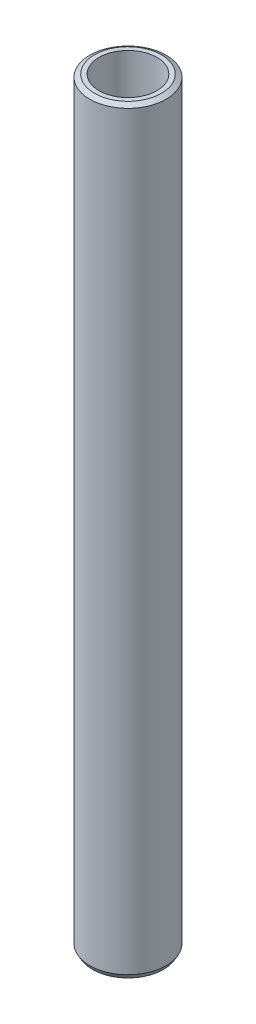
from build123d import *
from OCP.BRepFilletAPI import BRepFilletAPI_MakeChamfer

# Parameters (mm, degrees)
SKETCH1_R           = 27.5
BOSS_EXTRUDE1_DEPTH = 545.613754605
SKETCH2_R           = 20.810549987
CUT_EXTRUDE1_DEPTH  = 547.998052295
CHAMFER1_SIZE       = 1.971205417
CHAMFER1_SIZE2      = 3.414227934


with BuildPart() as part:
    # Sketch1 → Boss-Extrude1 (new body)
    with BuildSketch(Plane(origin=(0, 0, 0), x_dir=(1, 0, 0), z_dir=(0, 1, 0))):
        Circle(SKETCH1_R)
    extrude(amount=BOSS_EXTRUDE1_DEPTH)

    # Sketch2 → Cut-Extrude1 (cut, through all)
    with BuildSketch(Plane(origin=(0, 0, 0), x_dir=(1, 0, 0), z_dir=(0, 1, 0))):
        Circle(SKETCH2_R)
    extrude(amount=CUT_EXTRUDE1_DEPTH, mode=Mode.SUBTRACT)

    # Chamfer1: one chamfer whose edges measure the first distance from different faces: ONE call of the kernel's chamfer builder (chamfer() names one face for all edges)
    chamfer1_edges_1 = [part.edges().sort_by_distance(p)[0] for p in [
        (-27.5, 545.613754605, 0),
    ]]
    chamfer1_side_1 = [part.faces().sort_by_distance(p)[0] for p in [
        (-27.5, 272.806877303, 0),
    ]]
    chamfer1_edges_2 = [part.edges().sort_by_distance(p)[0] for p in [
        (-27.5, 0, 0),
    ]]
    chamfer1_side_2 = [part.faces().sort_by_distance(p)[0] for p in [
        (-26.722182541, 0, 0),
    ]]
    chamfer1 = BRepFilletAPI_MakeChamfer(part.part.solid().wrapped)
    for e in chamfer1_edges_1:
        chamfer1.Add(CHAMFER1_SIZE, CHAMFER1_SIZE2, e.wrapped, chamfer1_side_1[0].wrapped)  # the first distance lies on this face
    for e in chamfer1_edges_2:
        chamfer1.Add(CHAMFER1_SIZE, CHAMFER1_SIZE2, e.wrapped, chamfer1_side_2[0].wrapped)  # the first distance lies on this face
    add(Compound.cast(chamfer1.Shape()), mode=Mode.REPLACE)


solid = part.part
